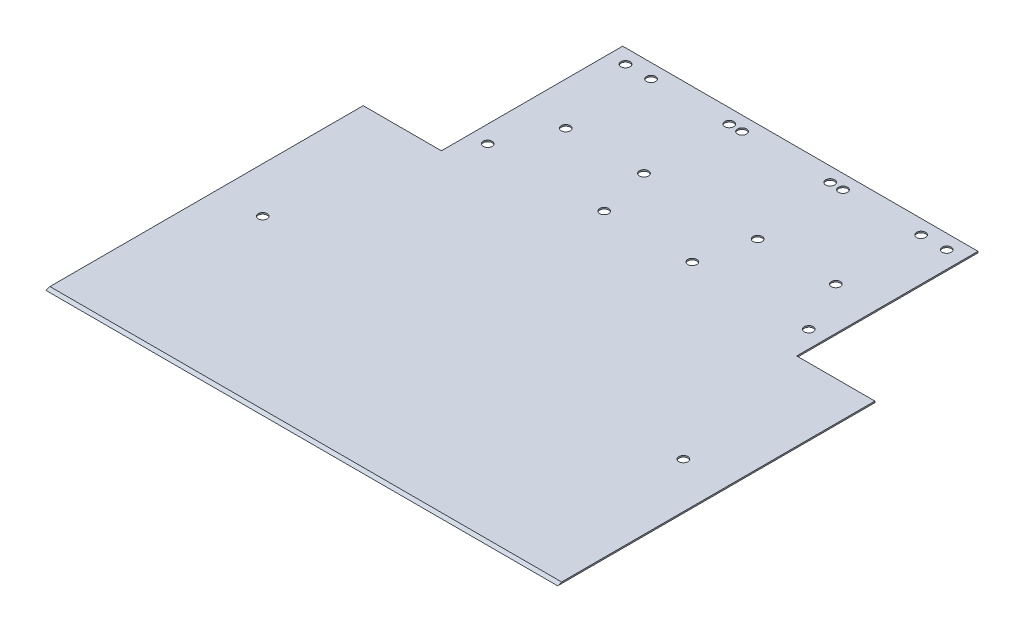
from build123d import *

# Parameters (mm, degrees)
SALIENTE_EXTRUIR1_DEPTH = 0.5
CORTAR_EXTRUIR4_REACH   = 128.793
CROQUIS6_R              = 1.585
CORTAR_EXTRUIR5_REACH   = 128.793
CROQUIS7_R              = 1.585
CORTAR_EXTRUIR6_REACH   = 128.793
CROQUIS8_R              = 1.585
CORTAR_EXTRUIR7_REACH   = 128.793
CROQUIS9_R              = 1.585
CORTAR_EXTRUIR8_REACH   = 128.793
CROQUIS5_R              = 1.585
CORTAR_EXTRUIR9_REACH   = 202.939


with BuildPart() as part:
    # Croquis2 → Saliente-Extruir1 (new body)
    with BuildSketch(Plane(origin=(0, 0, 0), x_dir=(1, 0, 0), z_dir=(0, 1, 0))):
        Polygon((-90, 25.54), (-62.5, 25.54), (-62.5, 89.31), (62.5, 89.31), (62.5, 25.54), (90, 25.54), (90, -86.05), (-90, -86.05), align=None)
    saliente_extruir1 = extrude(amount=SALIENTE_EXTRUIR1_DEPTH)

    # Croquis6 → Cortar-Extruir4 (cut, up to next)
    with BuildSketch(Plane(origin=(0, 0.5, 0), x_dir=(1, 0, 0), z_dir=(0, 1, 0)), mode=Mode.PRIVATE) as cortar_extruir4_sk1:
        with Locations((-56.5, 35.81)):
            Circle(CROQUIS6_R)
    cortar_extruir4_tool1 = extrude(cortar_extruir4_sk1.sketch, amount=-CORTAR_EXTRUIR4_REACH, mode=Mode.PRIVATE) & part.part
    # Croquis6 → Cortar-Extruir4 (cut, up to next)
    with BuildSketch(Plane(origin=(0, 0.5, 0), x_dir=(1, 0, 0), z_dir=(0, 1, 0)), mode=Mode.PRIVATE) as cortar_extruir4_sk2:
        with Locations((-15.5, 35.81)):
            Circle(CROQUIS6_R)
    cortar_extruir4_tool2 = extrude(cortar_extruir4_sk2.sketch, amount=-CORTAR_EXTRUIR4_REACH, mode=Mode.PRIVATE) & part.part
    # Croquis6 → Cortar-Extruir4 (cut, up to next)
    with BuildSketch(Plane(origin=(0, 0.5, 0), x_dir=(1, 0, 0), z_dir=(0, 1, 0)), mode=Mode.PRIVATE) as cortar_extruir4_sk3:
        with Locations((-15.5, 84.31)):
            Circle(CROQUIS6_R)
    cortar_extruir4_tool3 = extrude(cortar_extruir4_sk3.sketch, amount=-CORTAR_EXTRUIR4_REACH, mode=Mode.PRIVATE) & part.part
    # Croquis6 → Cortar-Extruir4 (cut, up to next)
    with BuildSketch(Plane(origin=(0, 0.5, 0), x_dir=(1, 0, 0), z_dir=(0, 1, 0)), mode=Mode.PRIVATE) as cortar_extruir4_sk4:
        with Locations((-56.5, 84.31)):
            Circle(CROQUIS6_R)
    cortar_extruir4_tool4 = extrude(cortar_extruir4_sk4.sketch, amount=-CORTAR_EXTRUIR4_REACH, mode=Mode.PRIVATE) & part.part
    add(cortar_extruir4_tool1.solids().sort_by_distance((-56.5, 0.5, -35.81))[0], mode=Mode.SUBTRACT)
    add(cortar_extruir4_tool2.solids().sort_by_distance((-15.5, 0.5, -35.81))[0], mode=Mode.SUBTRACT)
    add(cortar_extruir4_tool3.solids().sort_by_distance((-15.5, 0.5, -84.31))[0], mode=Mode.SUBTRACT)
    add(cortar_extruir4_tool4.solids().sort_by_distance((-56.5, 0.5, -84.31))[0], mode=Mode.SUBTRACT)

    # Croquis7 → Cortar-Extruir5 (cut, up to next)
    with BuildSketch(Plane(origin=(0, 0.5, 0), x_dir=(1, 0, 0), z_dir=(0, 1, 0)), mode=Mode.PRIVATE) as cortar_extruir5_sk1:
        with Locations((56.5, 35.81)):
            Circle(CROQUIS7_R)
    cortar_extruir5_tool1 = extrude(cortar_extruir5_sk1.sketch, amount=-CORTAR_EXTRUIR5_REACH, mode=Mode.PRIVATE) & part.part
    # Croquis7 → Cortar-Extruir5 (cut, up to next)
    with BuildSketch(Plane(origin=(0, 0.5, 0), x_dir=(1, 0, 0), z_dir=(0, 1, 0)), mode=Mode.PRIVATE) as cortar_extruir5_sk2:
        with Locations((15.5, 35.81)):
            Circle(CROQUIS7_R)
    cortar_extruir5_tool2 = extrude(cortar_extruir5_sk2.sketch, amount=-CORTAR_EXTRUIR5_REACH, mode=Mode.PRIVATE) & part.part
    # Croquis7 → Cortar-Extruir5 (cut, up to next)
    with BuildSketch(Plane(origin=(0, 0.5, 0), x_dir=(1, 0, 0), z_dir=(0, 1, 0)), mode=Mode.PRIVATE) as cortar_extruir5_sk3:
        with Locations((15.5, 84.31)):
            Circle(CROQUIS7_R)
    cortar_extruir5_tool3 = extrude(cortar_extruir5_sk3.sketch, amount=-CORTAR_EXTRUIR5_REACH, mode=Mode.PRIVATE) & part.part
    # Croquis7 → Cortar-Extruir5 (cut, up to next)
    with BuildSketch(Plane(origin=(0, 0.5, 0), x_dir=(1, 0, 0), z_dir=(0, 1, 0)), mode=Mode.PRIVATE) as cortar_extruir5_sk4:
        with Locations((56.5, 84.31)):
            Circle(CROQUIS7_R)
    cortar_extruir5_tool4 = extrude(cortar_extruir5_sk4.sketch, amount=-CORTAR_EXTRUIR5_REACH, mode=Mode.PRIVATE) & part.part
    add(cortar_extruir5_tool1.solids().sort_by_distance((56.5, 0.5, -35.81))[0], mode=Mode.SUBTRACT)
    add(cortar_extruir5_tool2.solids().sort_by_distance((15.5, 0.5, -35.81))[0], mode=Mode.SUBTRACT)
    add(cortar_extruir5_tool3.solids().sort_by_distance((15.5, 0.5, -84.31))[0], mode=Mode.SUBTRACT)
    add(cortar_extruir5_tool4.solids().sort_by_distance((56.5, 0.5, -84.31))[0], mode=Mode.SUBTRACT)

    # Simetría3: Saliente-Extruir1 across plane
    add(saliente_extruir1.mirror(Plane(origin=(0, 0, 0), x_dir=(0, 0, 1), z_dir=(1, 0, 0))))

    # Croquis8 → Cortar-Extruir6 (cut, up to next)
    with BuildSketch(Plane(origin=(0, 0.5, 0), x_dir=(1, 0, 0), z_dir=(0, 1, 0)), mode=Mode.PRIVATE) as cortar_extruir6_sk1:
        with Locations((-20, 54.31)):
            Circle(CROQUIS8_R)
    cortar_extruir6_tool1 = extrude(cortar_extruir6_sk1.sketch, amount=-CORTAR_EXTRUIR6_REACH, mode=Mode.PRIVATE) & part.part
    # Croquis8 → Cortar-Extruir6 (cut, up to next)
    with BuildSketch(Plane(origin=(0, 0.5, 0), x_dir=(1, 0, 0), z_dir=(0, 1, 0)), mode=Mode.PRIVATE) as cortar_extruir6_sk2:
        with Locations((-47.5, 54.31)):
            Circle(CROQUIS8_R)
    cortar_extruir6_tool2 = extrude(cortar_extruir6_sk2.sketch, amount=-CORTAR_EXTRUIR6_REACH, mode=Mode.PRIVATE) & part.part
    # Croquis8 → Cortar-Extruir6 (cut, up to next)
    with BuildSketch(Plane(origin=(0, 0.5, 0), x_dir=(1, 0, 0), z_dir=(0, 1, 0)), mode=Mode.PRIVATE) as cortar_extruir6_sk3:
        with Locations((-47.5, 84.31)):
            Circle(CROQUIS8_R)
    cortar_extruir6_tool3 = extrude(cortar_extruir6_sk3.sketch, amount=-CORTAR_EXTRUIR6_REACH, mode=Mode.PRIVATE) & part.part
    # Croquis8 → Cortar-Extruir6 (cut, up to next)
    with BuildSketch(Plane(origin=(0, 0.5, 0), x_dir=(1, 0, 0), z_dir=(0, 1, 0)), mode=Mode.PRIVATE) as cortar_extruir6_sk4:
        with Locations((-20, 84.31)):
            Circle(CROQUIS8_R)
    cortar_extruir6_tool4 = extrude(cortar_extruir6_sk4.sketch, amount=-CORTAR_EXTRUIR6_REACH, mode=Mode.PRIVATE) & part.part
    cortar_extruir6_1 = cortar_extruir6_tool1.solids().sort_by_distance((-20, 0.5, -54.31))[0]
    add(cortar_extruir6_1, mode=Mode.SUBTRACT)
    cortar_extruir6_2 = cortar_extruir6_tool2.solids().sort_by_distance((-47.5, 0.5, -54.31))[0]
    add(cortar_extruir6_2, mode=Mode.SUBTRACT)
    cortar_extruir6_3 = cortar_extruir6_tool3.solids().sort_by_distance((-47.5, 0.5, -84.31))[0]
    add(cortar_extruir6_3, mode=Mode.SUBTRACT)
    cortar_extruir6_4 = cortar_extruir6_tool4.solids().sort_by_distance((-20, 0.5, -84.31))[0]
    add(cortar_extruir6_4, mode=Mode.SUBTRACT)
    cortar_extruir6 = cortar_extruir6_1 + cortar_extruir6_2 + cortar_extruir6_3 + cortar_extruir6_4  # Cortar-Extruir6 as one shape, for the pattern or mirror that repeats it

    # Simetría4: Cortar-Extruir6 across plane
    add(cortar_extruir6.mirror(Plane(origin=(0, 0, 0), x_dir=(0, 0, 1), z_dir=(1, 0, 0))), mode=Mode.SUBTRACT)

    # Croquis9 → Cortar-Extruir7 (cut, up to next)
    with BuildSketch(Plane.XZ, mode=Mode.PRIVATE) as cortar_extruir7_sk1:
        with Locations((56.5, -35.81)):
            Circle(CROQUIS9_R)
    cortar_extruir7_tool1 = extrude(cortar_extruir7_sk1.sketch, amount=-CORTAR_EXTRUIR7_REACH, mode=Mode.PRIVATE) & part.part
    # Croquis9 → Cortar-Extruir7 (cut, up to next)
    with BuildSketch(Plane.XZ, mode=Mode.PRIVATE) as cortar_extruir7_sk2:
        with Locations((15.5, -35.81)):
            Circle(CROQUIS9_R)
    cortar_extruir7_tool2 = extrude(cortar_extruir7_sk2.sketch, amount=-CORTAR_EXTRUIR7_REACH, mode=Mode.PRIVATE) & part.part
    # Croquis9 → Cortar-Extruir7 (cut, up to next)
    with BuildSketch(Plane.XZ, mode=Mode.PRIVATE) as cortar_extruir7_sk3:
        with Locations((15.5, -84.31)):
            Circle(CROQUIS9_R)
    cortar_extruir7_tool3 = extrude(cortar_extruir7_sk3.sketch, amount=-CORTAR_EXTRUIR7_REACH, mode=Mode.PRIVATE) & part.part
    # Croquis9 → Cortar-Extruir7 (cut, up to next)
    with BuildSketch(Plane.XZ, mode=Mode.PRIVATE) as cortar_extruir7_sk4:
        with Locations((56.5, -84.31)):
            Circle(CROQUIS9_R)
    cortar_extruir7_tool4 = extrude(cortar_extruir7_sk4.sketch, amount=-CORTAR_EXTRUIR7_REACH, mode=Mode.PRIVATE) & part.part
    cortar_extruir7_1 = cortar_extruir7_tool1.solids().sort_by_distance((56.5, 0, -35.81))[0]
    add(cortar_extruir7_1, mode=Mode.SUBTRACT)
    cortar_extruir7_2 = cortar_extruir7_tool2.solids().sort_by_distance((15.5, 0, -35.81))[0]
    add(cortar_extruir7_2, mode=Mode.SUBTRACT)
    cortar_extruir7_3 = cortar_extruir7_tool3.solids().sort_by_distance((15.5, 0, -84.31))[0]
    add(cortar_extruir7_3, mode=Mode.SUBTRACT)
    cortar_extruir7_4 = cortar_extruir7_tool4.solids().sort_by_distance((56.5, 0, -84.31))[0]
    add(cortar_extruir7_4, mode=Mode.SUBTRACT)
    cortar_extruir7 = cortar_extruir7_1 + cortar_extruir7_2 + cortar_extruir7_3 + cortar_extruir7_4  # Cortar-Extruir7 as one shape, for the pattern or mirror that repeats it

    # Simetría5: Cortar-Extruir7 across plane
    add(cortar_extruir7.mirror(Plane(origin=(0, 0, 0), x_dir=(0, 0, 1), z_dir=(1, 0, 0))), mode=Mode.SUBTRACT)

    # Croquis5 → Cortar-Extruir8 (cut, up to next)
    with BuildSketch(Plane(origin=(0, 0.5, 0), x_dir=(1, 0, 0), z_dir=(0, 1, 0)), mode=Mode.PRIVATE) as cortar_extruir8_sk1:
        with Locations((74, -25.820403824)):
            Circle(CROQUIS5_R)
    cortar_extruir8_tool1 = extrude(cortar_extruir8_sk1.sketch, amount=-CORTAR_EXTRUIR8_REACH, mode=Mode.PRIVATE) & part.part
    cortar_extruir8 = cortar_extruir8_tool1.solids().sort_by_distance((74, 0.5, 25.820404))[0]
    add(cortar_extruir8, mode=Mode.SUBTRACT)

    # Simetría6: Cortar-Extruir8 across plane
    add(cortar_extruir8.mirror(Plane(origin=(0, 0, 0), x_dir=(0, 0, 1), z_dir=(1, 0, 0))), mode=Mode.SUBTRACT)

    # Croquis3 → Cortar-Extruir9 (cut, up to next)
    with BuildSketch(Plane(origin=(90, 0, 0), x_dir=(0, 0, -1), z_dir=(1, 0, 0)), mode=Mode.PRIVATE) as cortar_extruir9_sk1:
        Polygon((-86.05, 0), (-84.67626129, 0.5), (-86.05, 0.5), align=None)
    cortar_extruir9_tool1 = extrude(cortar_extruir9_sk1.sketch, amount=-CORTAR_EXTRUIR9_REACH, mode=Mode.PRIVATE) & part.part
    add(cortar_extruir9_tool1.solids().sort_by_distance((90, 0.333333, 85.592087))[0], mode=Mode.SUBTRACT)


solid = part.part
